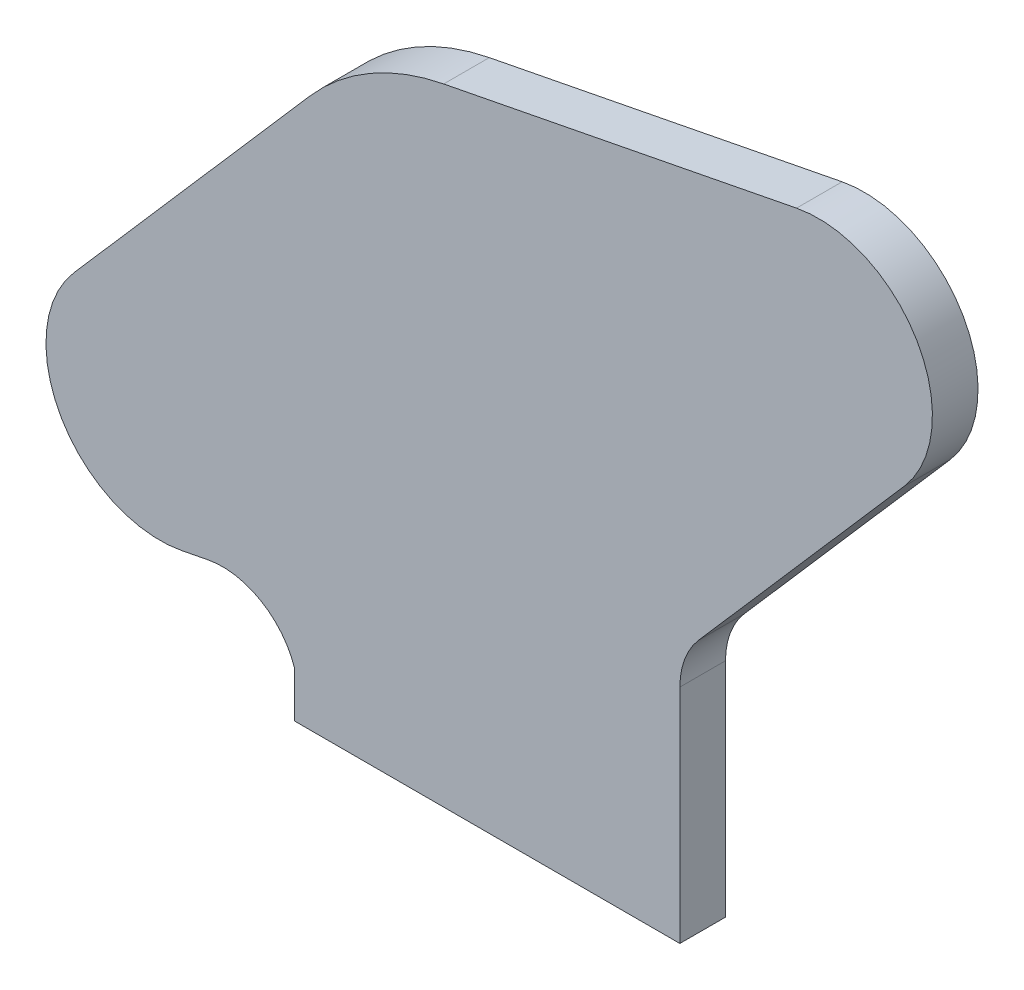
from build123d import *

# Parameters (mm, degrees)
BOSS_EXTRUDE2_DEPTH = 1.905


with BuildPart() as part:
    # Sketch2 → Boss-Extrude2 (new body)
    with BuildSketch(Plane.XY.offset(0.762)):
        with BuildLine():
            Line((-6.3754, -16.4211), (6.3754, -16.4211))
            Line((6.3754, -16.4211), (7.9629, -16.4211))
            Line((7.9629, -16.4211), (7.9629, -7.147799047))
            ThreePointArc((7.9629, -7.147799047), (8.164417647, -6.034682837), (8.743389889, -5.062865876))
            Line((8.743389889, -5.062865876), (17.339918451, 4.810100243))
            ThreePointArc((17.339918451, 4.810100243), (17.872599271, 10.31875), (12.835628231, 12.611759757))
            Line((12.835628231, 12.611759757), (-1.900485513, 9.734924987))
            ThreePointArc((-1.900485513, 9.734924987), (-4.95935, 8.589846173), (-7.480449586, 6.513331227))
            Line((-7.480449586, 6.513331227), (-17.339918451, -4.810100243))
            ThreePointArc((-17.339918451, -4.810100243), (-17.872599271, -10.31875), (-12.835628231, -12.611759757))
            Line((-12.835628231, -12.611759757), (-11.746250036, -12.399087602))
            ThreePointArc((-11.746250036, -12.399087602), (-9.535762198, -12.774133366), (-8.124214092, -14.5161))
            Line((-8.124214092, -14.5161), (-8.124214092, -16.4211))
            Line((-8.124214092, -16.4211), (-6.3754, -16.4211))
        make_face()
    extrude(amount=BOSS_EXTRUDE2_DEPTH)


solid = part.part
